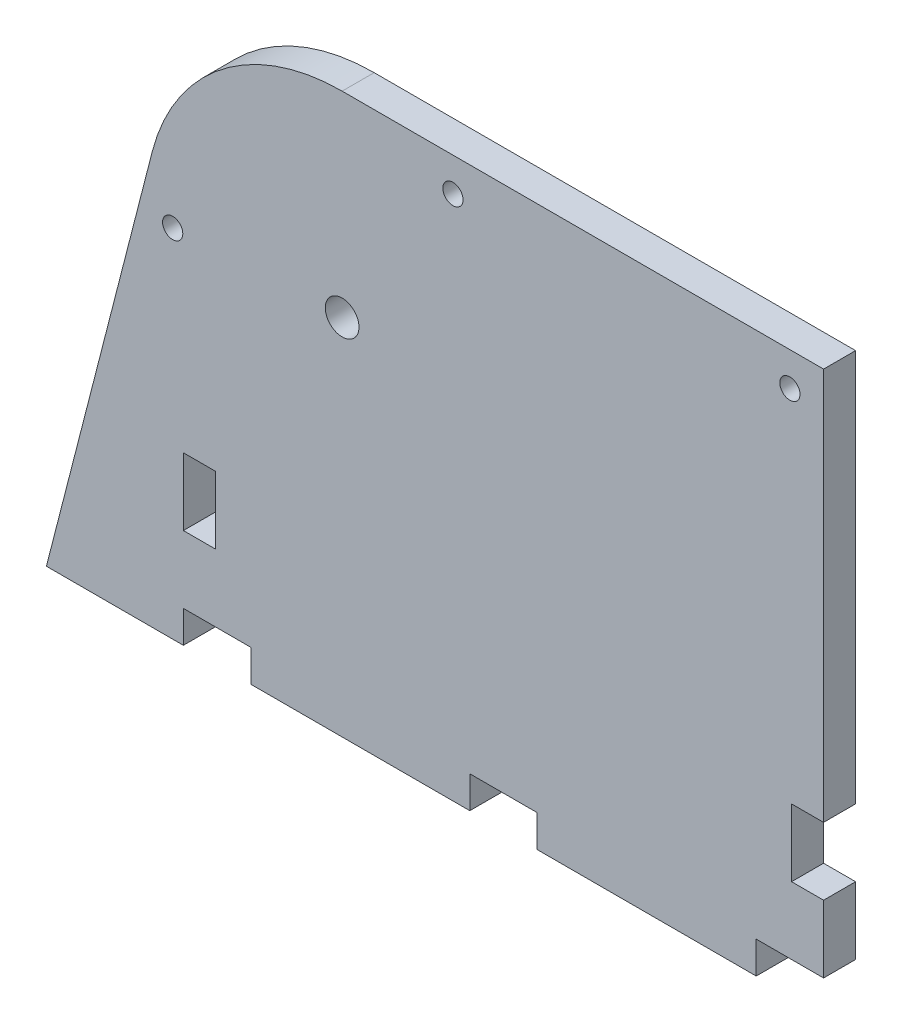
from build123d import *

# Parameters (mm, degrees)
SKETCH1_R           = 2.5
BOSS_EXTRUDE1_DEPTH = 4.75
SKETCH2_W           = 10
SKETCH2_H           = 4.75
SKETCH2_W_2         = 4.75
SKETCH2_H_2         = 10
CUT_EXTRUDE1_DEPTH  = 134.927452376
SKETCH3_R           = 1.5
CUT_EXTRUDE2_DEPTH  = 134.927452376
CAVITY1_OUTLINE_R   = 1.5
CAVITY1_DEPTH       = 4.75


# Read off the part's stored shape, not the designer's step: Cavity1
with BuildPart() as part:
    # Sketch1 → Boss-Extrude1 (new body)
    with BuildSketch(Plane.XY):
        with BuildLine():
            Line((-9.685424338, 2.488484559), (5.386220056, 61.148792841))
            ThreePointArc((5.386220056, 61.148792841), (15.733633721, 76.897010412), (33.561388608, 83))
            Line((33.561388608, 83), (105, 83))
            Line((105, 83), (105, 0))
            Line((105, 0), (-10.324792855, 0))
            Line((-10.324792855, 0), (-9.685424338, 2.488484559))
        make_face()
        with Locations((33.561388608, 53.909722104)):
            Circle(SKETCH1_R, mode=Mode.SUBTRACT)
    extrude(amount=BOSS_EXTRUDE1_DEPTH)

    # Sketch2 → Cut-Extrude1 (cut, through all)
    with BuildSketch(Plane.XY.offset(4.75)):
        with Locations((15, 2.375)):
            Rectangle(SKETCH2_W, SKETCH2_H)
        with Locations((57.5, 2.375)):
            Rectangle(SKETCH2_W, SKETCH2_H)
        with Locations((100, 2.375)):
            Rectangle(SKETCH2_W, SKETCH2_H)
        with Locations((102.625, 19.75)):
            Rectangle(SKETCH2_W_2, SKETCH2_H_2)
        with Locations((12.375, 19.75)):
            Rectangle(SKETCH2_W_2, SKETCH2_H_2)
    extrude(amount=-CUT_EXTRUDE1_DEPTH, mode=Mode.SUBTRACT)

    # Sketch3 → Cut-Extrude2 (cut, through all)
    with BuildSketch(Plane.XY.offset(4.75)):
        with Locations((50, 78)):
            Circle(SKETCH3_R)
        with Locations((100, 78)):
            Circle(SKETCH3_R)
    extrude(amount=-CUT_EXTRUDE2_DEPTH, mode=Mode.SUBTRACT)

    # Cavity1 outline → Cavity1 (cut)
    with BuildSketch(Plane.XY):
        with Locations((8.414860226, 52.844005614)):
            Circle(CAVITY1_OUTLINE_R)
    extrude(amount=CAVITY1_DEPTH, mode=Mode.SUBTRACT)


solid = part.part
